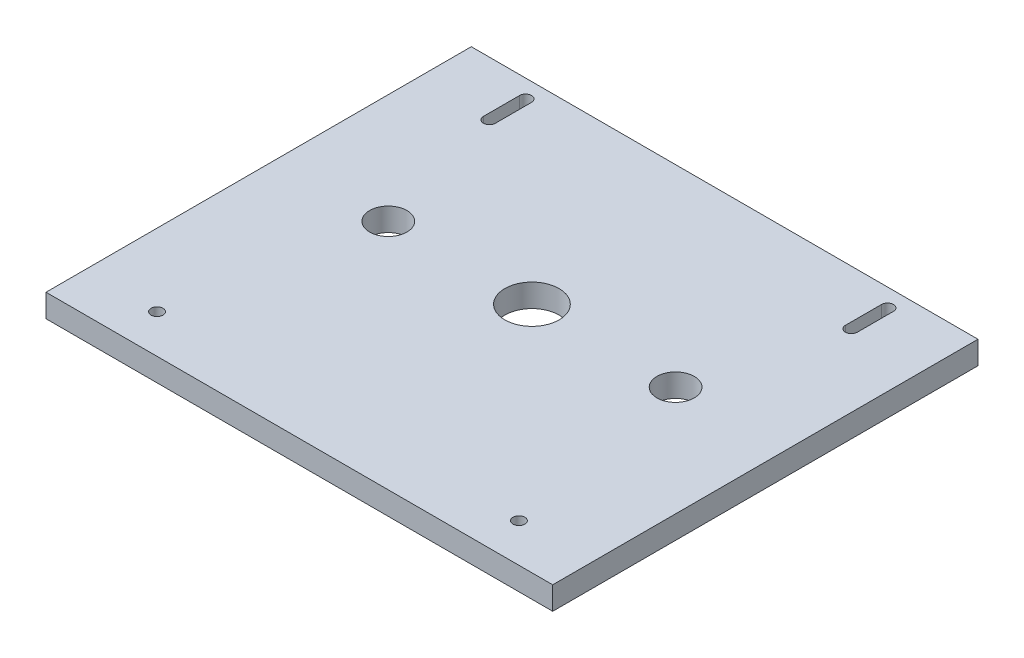
from build123d import *

# Parameters (mm, degrees)
SKETCH1_W           = 140
SKETCH1_H           = 117.505
BOSS_EXTRUDE1_DEPTH = 6.35
SKETCH2_R           = 1.65
SKETCH2_R_2         = 7.5
SKETCH2_R_3         = 5.16
CUT_EXTRUDE1_DEPTH  = 183.887253588


with BuildPart() as part:
    # Sketch1 → Boss-Extrude1 (new body)
    with BuildSketch(Plane(origin=(0, 0, 0), x_dir=(1, 0, 0), z_dir=(0, 1, 0))):
        with Locations((70, 58.7525)):
            Rectangle(SKETCH1_W, SKETCH1_H)
    extrude(amount=BOSS_EXTRUDE1_DEPTH)

    # Sketch2 → Cut-Extrude1 (cut, through all)
    with BuildSketch(Plane(origin=(0, 6.35, 0), x_dir=(1, 0, 0), z_dir=(0, 1, 0))):
        with Locations((20, 10.675)):
            Circle(SKETCH2_R)
        with Locations((70, 64.265)):
            Circle(SKETCH2_R_2)
        with Locations((30.3125, 64.265)):
            Circle(SKETCH2_R_3)
        with Locations((120, 10.675)):
            Circle(SKETCH2_R)
        with Locations((109.6875, 64.265)):
            Circle(SKETCH2_R_3)
        with BuildLine():
            Line((18.35, 102.505), (18.35, 112.505))
            ThreePointArc((18.35, 112.505), (20, 114.155), (21.65, 112.505))
            Line((21.65, 112.505), (21.65, 102.505))
            ThreePointArc((21.65, 102.505), (20, 100.855), (18.35, 102.505))
        make_face()
        with BuildLine():
            Line((121.65, 102.505), (121.65, 112.505))
            ThreePointArc((121.65, 112.505), (120, 114.155), (118.35, 112.505))
            Line((118.35, 112.505), (118.35, 102.505))
            ThreePointArc((118.35, 102.505), (120, 100.855), (121.65, 102.505))
        make_face()
    extrude(amount=-CUT_EXTRUDE1_DEPTH, mode=Mode.SUBTRACT)


solid = part.part
